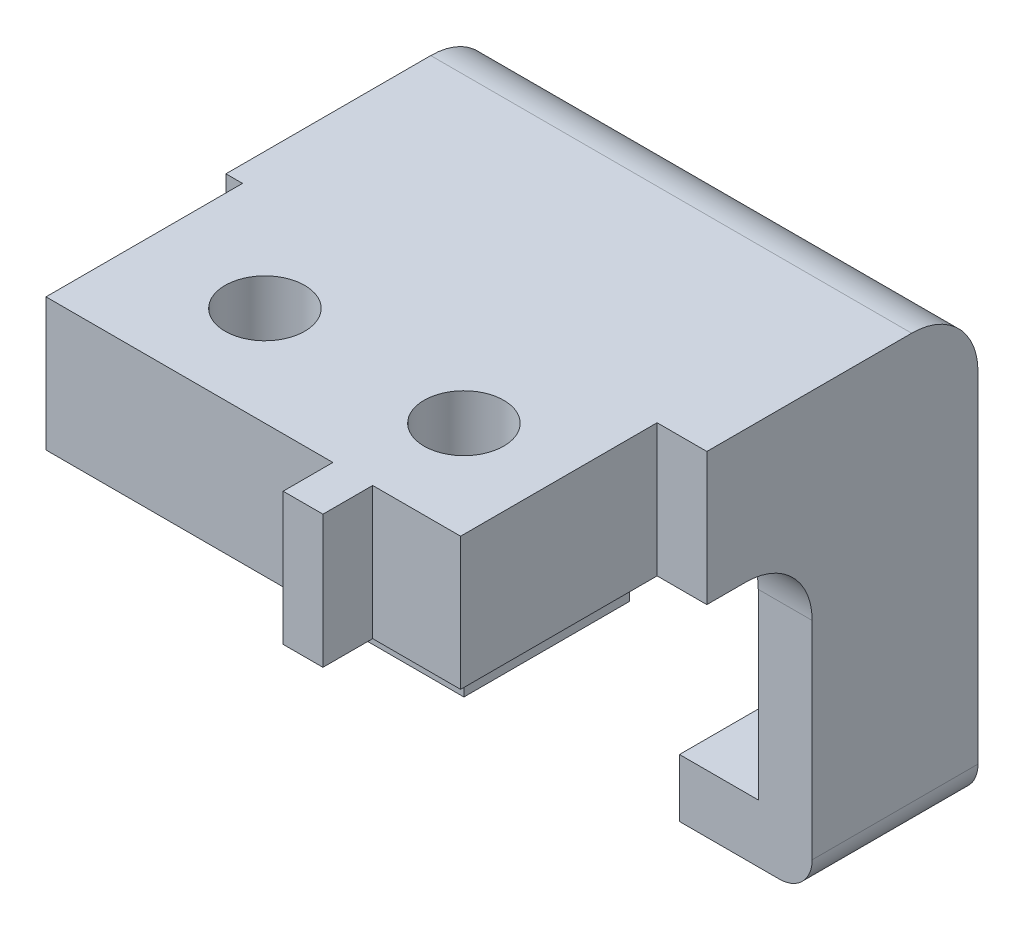
from build123d import *
from OCP.BRepFilletAPI import BRepFilletAPI_MakeChamfer
from build123d.topology import SkipClean

# Parameters (mm, degrees)
SKETCH1_R                      = 3.1
SKETCH1_R_2                    = 3.5
SKETCH1_W                      = 32
SKETCH1_H                      = 15.65
BOSS_EXTRUDE1_DEPTH            = 11.7
CUT_EXTRUDE5_DEPTH             = 14
CUT_EXTRUDE8_REACH             = 96.23
SKETCH10_R                     = 1.675
CUT_EXTRUDE8_DIRECTION_2_REACH = 96.23
CUT_EXTRUDE9_REACH             = 94.724
SKETCH11_R                     = 1.625
CUT_EXTRUDE9_DIRECTION_2_REACH = 94.724
CUT_EXTRUDE10_DEPTH            = 2.3
CUT_EXTRUDE11_DEPTH            = 2.3
HOLE1_D                        = 4.8
HOLE1_DEPTH                    = 12
HOLE1_CBORE_D                  = 5.4
HOLE1_CBORE_DEPTH              = 6
CUT_EXTRUDE17_REACH            = 66.001
SKETCH30_W                     = 59.4
SKETCH30_H                     = 25.65
SKETCH32_W                     = 99
SKETCH32_H                     = 8
CUT_EXTRUDE20_DEPTH            = 65.000566192
CHAMFER1_SIZE                  = 6
CHAMFER1_SIZE_2                = 0.3
FILLET1_R                      = 2
SKETCH33_W                     = 2.4
SKETCH33_H                     = 5.3
BOSS_EXTRUDE2_DEPTH            = 3
SKETCH34_W                     = 99
SKETCH34_H                     = 8
CUT_EXTRUDE21_DEPTH            = 61.759087383
CUT_EXTRUDE22_START            = -11.7
CUT_EXTRUDE22_DEPTH            = 11.7
BOSS_EXTRUDE4_DEPTH            = 8
SKETCH37_W                     = 25
SKETCH37_H                     = 8
BOSS_EXTRUDE5_DEPTH            = 16.5
SKETCH39_W                     = 25
SKETCH39_H                     = 10
BOSS_EXTRUDE6_DEPTH            = 15
SKETCH40_W                     = 22.5
SKETCH40_H                     = 12
CUT_EXTRUDE23_DEPTH            = 72.876300078
FILLET2_R                      = 4
CUT_EXTRUDE26_DEPTH            = 67.820749119
SKETCH49_W                     = 5
SKETCH49_H                     = 3.5
SKETCH49_W_2                   = 7
BOSS_EXTRUDE7_DEPTH            = 10
M4_CLEARANCE_HOLE1_D           = 4.8
CUT_EXTRUDE27_DEPTH            = 3.25
BOSS_EXTRUDE9_DEPTH            = 3
CHAMFER2_START                 = 11.446819666
CHAMFER2_DEPTH                 = 22.5
BOSS_EXTRUDE10_START           = -25
BOSS_EXTRUDE10_DEPTH           = 1
FILLET3_R                      = 2


with BuildPart() as part:
    # Sketch1 → Boss-Extrude1 (new body)
    with BuildSketch(Plane.XY):
        Polygon((-43.303180334, 29.275360835), (25.696819666, 29.275360835), (55.696819666, 29.275360835), (55.696819666, -18.024639165), (-43.303180334, -18.024639165), align=None)
        with Locations((-32.303180334, 10.275360835)):
            Circle(SKETCH1_R, mode=Mode.SUBTRACT)
        with Locations((44.696819666, 10.275360835)):
            Circle(SKETCH1_R, mode=Mode.SUBTRACT)
        with Locations((22.696819666, 12.275360835)):
            Circle(SKETCH1_R_2, mode=Mode.SUBTRACT)
        with Locations((-6.803180334, 11.450360835)):
            Rectangle(SKETCH1_W, SKETCH1_H, mode=Mode.SUBTRACT)
    extrude(amount=-BOSS_EXTRUDE1_DEPTH)

    # Sketch7 → Cut-Extrude5 (cut)
    with BuildSketch(Plane.XY):
        with BuildLine():
            Line((-43.303180334, 22.775360835), (-22.503180334, 22.775360835))
            Line((-22.503180334, 22.775360835), (-22.503180334, 3.625360835))
            Line((-22.503180334, 3.625360835), (-24.503180334, 3.625360835))
            Line((-24.503180334, 3.625360835), (-24.503180334, 21.275360835))
            Line((-24.503180334, 21.275360835), (-31.503180334, 21.275360835))
            Line((-31.503180334, 21.275360835), (-31.503180334, 13.270356662))
            ThreePointArc((-31.503180334, 13.270356662), (-32.303180334, 7.175360835), (-33.103180334, 13.270356662))
            Line((-33.103180334, 13.270356662), (-33.103180334, 21.275360835))
            Line((-33.103180334, 21.275360835), (-40.103180334, 21.275360835))
            Line((-40.103180334, 21.275360835), (-40.103180334, 3.625360835))
            Line((-40.103180334, 3.625360835), (-43.303180334, 3.625360835))
            Line((-43.303180334, 3.625360835), (-43.303180334, 22.775360835))
        make_face()
        with BuildLine():
            Line((34.896819666, 22.775360835), (55.696819666, 22.775360835))
            Line((55.696819666, 22.775360835), (55.696819666, 3.625360835))
            Line((55.696819666, 3.625360835), (52.496819666, 3.625360835))
            Line((52.496819666, 3.625360835), (52.496819666, 21.275360835))
            Line((52.496819666, 21.275360835), (45.496819666, 21.275360835))
            Line((45.496819666, 21.275360835), (45.496819666, 13.270356662))
            ThreePointArc((45.496819666, 13.270356662), (44.696819666, 7.175360835), (43.896819666, 13.270356662))
            Line((43.896819666, 13.270356662), (43.896819666, 21.275360835))
            Line((43.896819666, 21.275360835), (36.896819666, 21.275360835))
            Line((36.896819666, 21.275360835), (36.896819666, 3.625360835))
            Line((36.896819666, 3.625360835), (34.896819666, 3.625360835))
            Line((34.896819666, 3.625360835), (34.896819666, 22.775360835))
        make_face()
    extrude(amount=-CUT_EXTRUDE5_DEPTH, mode=Mode.SUBTRACT)

    # Sketch10 → Cut-Extrude8 (cut, up to next)
    with BuildSketch(Plane(origin=(-33.103180334, 0, 0), x_dir=(0, 0, -1), z_dir=(1, 0, 0)), mode=Mode.PRIVATE) as cut_extrude8_sk1:
        with Locations(Location((5.85, 17.272858748, 0), (0, 0, 270))):
            Circle(SKETCH10_R)
    cut_extrude8_tool1 = extrude(cut_extrude8_sk1.sketch, amount=-CUT_EXTRUDE8_REACH, mode=Mode.PRIVATE) & part.part
    add(cut_extrude8_tool1.solids().sort_by_distance((-33.10318, 17.272859, -5.85))[0], mode=Mode.SUBTRACT)

    # Sketch10 → Cut-Extrude8 direction 2 (cut, up to next)
    with BuildSketch(Plane(origin=(-33.103180334, 0, 0), x_dir=(0, 0, -1), z_dir=(1, 0, 0)), mode=Mode.PRIVATE) as cut_extrude8_direction_2_sk1:
        with Locations(Location((5.85, 17.272858748, 0), (0, 0, 270))):
            Circle(SKETCH10_R)
    cut_extrude8_direction_2_tool1 = extrude(cut_extrude8_direction_2_sk1.sketch, amount=CUT_EXTRUDE8_DIRECTION_2_REACH, mode=Mode.PRIVATE) & part.part
    add(cut_extrude8_direction_2_tool1.solids().sort_by_distance((-33.10318, 17.272859, -5.85))[0], mode=Mode.SUBTRACT)

    # Sketch11 → Cut-Extrude9 (cut, up to next)
    with BuildSketch(Plane(origin=(43.896819666, 0, 0), x_dir=(0, 0, -1), z_dir=(1, 0, 0)), mode=Mode.PRIVATE) as cut_extrude9_sk1:
        with Locations(Location((5.85, 17.272858748, 0), (0, 0, 180))):
            Circle(SKETCH11_R)
    cut_extrude9_tool1 = extrude(cut_extrude9_sk1.sketch, amount=-CUT_EXTRUDE9_REACH, mode=Mode.PRIVATE) & part.part
    add(cut_extrude9_tool1.solids().sort_by_distance((43.89682, 17.272859, -5.85))[0], mode=Mode.SUBTRACT)

    # Sketch11 → Cut-Extrude9 direction 2 (cut, up to next)
    with BuildSketch(Plane(origin=(43.896819666, 0, 0), x_dir=(0, 0, -1), z_dir=(1, 0, 0)), mode=Mode.PRIVATE) as cut_extrude9_direction_2_sk1:
        with Locations(Location((5.85, 17.272858748, 0), (0, 0, 180))):
            Circle(SKETCH11_R)
    cut_extrude9_direction_2_tool1 = extrude(cut_extrude9_direction_2_sk1.sketch, amount=CUT_EXTRUDE9_DIRECTION_2_REACH, mode=Mode.PRIVATE) & part.part
    add(cut_extrude9_direction_2_tool1.solids().sort_by_distance((43.89682, 17.272859, -5.85))[0], mode=Mode.SUBTRACT)

    # Sketch12 → Cut-Extrude10 (cut)
    with BuildSketch(Plane.ZY.offset(-36.896819666)):
        Polygon((-4.146816706, 20.222858748), (0, 20.222858748), (0, 14.322858748), (-4.146816706, 14.322858748), (-7.553183294, 14.322858748), (-9.256366588, 17.272858748), (-7.553183294, 20.222858748), align=None)
    extrude(amount=-CUT_EXTRUDE10_DEPTH, mode=Mode.SUBTRACT)

    # Sketch13 → Cut-Extrude11 (cut)
    with BuildSketch(Plane(origin=(-24.503180334, 0, 0), x_dir=(0, 0, -1), z_dir=(1, 0, 0))):
        Polygon((4.146816706, 20.222858748), (0, 20.222858748), (0, 14.322858748), (4.146816706, 14.322858748), (7.553183294, 14.322858748), (9.256366588, 17.272858748), (7.553183294, 20.222858748), align=None)
    extrude(amount=-CUT_EXTRUDE11_DEPTH, mode=Mode.SUBTRACT)

    # Hole1
    with Locations(Plane(origin=(0, 3.625360835, 0), x_dir=(1, 0, 0), z_dir=(0, 1, 0))):
        with Locations((-15.653180334, 5.85), (0.346819666, 5.85)):
            CounterBoreHole(HOLE1_D / 2, HOLE1_CBORE_D / 2, HOLE1_CBORE_DEPTH, depth=HOLE1_DEPTH)

    # Sketch30 → Cut-Extrude17 (cut, up to next)
    with BuildSketch(Plane(origin=(0, 0, -11.7), x_dir=(-1, 0, 0), z_dir=(0, 0, -1)), mode=Mode.PRIVATE) as cut_extrude17_sk1:
        with Locations((-5.196819666, 16.450360835)):
            Rectangle(SKETCH30_W, SKETCH30_H)
    cut_extrude17_tool1 = extrude(cut_extrude17_sk1.sketch, amount=-CUT_EXTRUDE17_REACH, mode=Mode.PRIVATE) & part.part
    add(cut_extrude17_tool1.solids().sort_by_distance((5.19682, 16.450361, -11.7))[0], mode=Mode.SUBTRACT)


with BuildPart() as cut_extrude17_piece_1:
    # of the separate pieces the step leaves, piece 1, a body of its own (cut_extrude17_pieces)
    add(part.part.solids().sort_by_distance((-24.503180334, 3.625360835, 0))[0])

    # Chamfer1
    chamfer1_edges_1 = [cut_extrude17_piece_1.edges().sort_by_distance(p)[0] for p in [
        (-2.353180334, -2.374639165, -5.85),
    ]]
    chamfer1_side_1 = [cut_extrude17_piece_1.faces().sort_by_distance(p)[0] for p in [
        (-2.353180334, -2.368639165, -5.85),
    ]]
    chamfer1_edges_2 = [cut_extrude17_piece_1.edges().sort_by_distance(p)[0] for p in [
        (-18.353180334, -2.374639165, -5.85),
    ]]
    chamfer1_side_2 = [cut_extrude17_piece_1.faces().sort_by_distance(p)[0] for p in [
        (-18.353180334, -2.368639165, -5.85),
    ]]
    chamfer1 = BRepFilletAPI_MakeChamfer(cut_extrude17_piece_1.part.solid().wrapped)
    for e in chamfer1_edges_1:
        chamfer1.Add(CHAMFER1_SIZE - 0.0001, CHAMFER1_SIZE_2 - 0.0001, e.wrapped, chamfer1_side_1[0].wrapped)
    for e in chamfer1_edges_2:
        chamfer1.Add(CHAMFER1_SIZE - 0.0001, CHAMFER1_SIZE_2 - 0.0001, e.wrapped, chamfer1_side_2[0].wrapped)
    add(Compound.cast(chamfer1.Shape()), mode=Mode.REPLACE)  # a hair under: the kernel refuses the full size

    # Fillet1
    # the kernel refuses this fillet: 2 mm, written as the material it takes off along each edge
    with BuildSketch(Plane(origin=(50.496819666, 19.275360835, -2), x_dir=(1, 0, 0), z_dir=(0, 1, 0))) as fillet1_piece_1_section:
        Polygon((0, 0), (FILLET1_R, 0), (FILLET1_R, -FILLET1_R), (0, -FILLET1_R), align=None)
    fillet1_piece_1 = extrude(amount=FILLET1_R, mode=Mode.PRIVATE)
    fillet1_piece_1 = fillet1_piece_1 - Plane(origin=(50.496819666, 19.275360835, -2), x_dir=(-0.7071067811865475, 0, -0.7071067811865475), z_dir=(0, 1, 0)) * Sphere(FILLET1_R, mode=Mode.PRIVATE)
    add(fillet1_piece_1, mode=Mode.SUBTRACT)
    with BuildSketch(Plane(origin=(50.496819666, 19.275360835, -9.7), x_dir=(1, 0, 0), z_dir=(0, 1, 0))) as fillet1_piece_2_section:
        Polygon((0, 0), (FILLET1_R, 0), (FILLET1_R, FILLET1_R), (0, FILLET1_R), align=None)
    fillet1_piece_2 = extrude(amount=FILLET1_R, mode=Mode.PRIVATE)
    fillet1_piece_2 = fillet1_piece_2 - Plane(origin=(50.496819666, 19.275360835, -9.7), x_dir=(-0.7071067811865475, 0, 0.7071067811865475), z_dir=(0, 1, 0)) * Sphere(FILLET1_R, mode=Mode.PRIVATE)
    add(fillet1_piece_2, mode=Mode.SUBTRACT)
    with BuildSketch(Plane(origin=(38.896819666, 19.275360835, -9.7), x_dir=(-1, 0, 0), z_dir=(0, 0, -1))) as fillet1_piece_3_section:
        Polygon((0, 0), (FILLET1_R, 0), (FILLET1_R, FILLET1_R), (0, FILLET1_R), align=None)
    fillet1_piece_3 = extrude(amount=FILLET1_R, mode=Mode.PRIVATE)
    fillet1_piece_3 = fillet1_piece_3 - Plane(origin=(38.896819666, 19.275360835, -9.7), x_dir=(0.7071067811865475, -0.7071067811865475, 0), z_dir=(0, 0, -1)) * Sphere(FILLET1_R, mode=Mode.PRIVATE)
    add(fillet1_piece_3, mode=Mode.SUBTRACT)
    with BuildSketch(Plane(origin=(-38.103180334, 19.275360835, -2), x_dir=(0, 1, 0), z_dir=(-1, 0, 0))) as fillet1_piece_4_section:
        Polygon((0, 0), (FILLET1_R, 0), (FILLET1_R, -FILLET1_R), (0, -FILLET1_R), align=None)
    fillet1_piece_4 = extrude(amount=FILLET1_R, mode=Mode.PRIVATE)
    fillet1_piece_4 = fillet1_piece_4 - Plane(origin=(-38.103180334, 19.275360835, -2), x_dir=(0, -0.7071067811865475, -0.7071067811865475), z_dir=(-1, 0, 0)) * Sphere(FILLET1_R, mode=Mode.PRIVATE)
    add(fillet1_piece_4, mode=Mode.SUBTRACT)
    with BuildSketch(Plane(origin=(-38.103180334, 19.275360835, -9.7), x_dir=(0, 1, 0), z_dir=(-1, 0, 0))) as fillet1_piece_5_section:
        Polygon((0, 0), (FILLET1_R, 0), (FILLET1_R, FILLET1_R), (0, FILLET1_R), align=None)
    fillet1_piece_5 = extrude(amount=FILLET1_R, mode=Mode.PRIVATE)
    fillet1_piece_5 = fillet1_piece_5 - Plane(origin=(-38.103180334, 19.275360835, -9.7), x_dir=(0, -0.7071067811865475, 0.7071067811865475), z_dir=(-1, 0, 0)) * Sphere(FILLET1_R, mode=Mode.PRIVATE)
    add(fillet1_piece_5, mode=Mode.SUBTRACT)
    with BuildSketch(Plane(origin=(-26.503180334, 19.275360835, -9.7), x_dir=(0, 0, -1), z_dir=(1, 0, 0))) as fillet1_piece_6_section:
        Polygon((0, 0), (FILLET1_R, 0), (FILLET1_R, FILLET1_R), (0, FILLET1_R), align=None)
    fillet1_piece_6 = extrude(amount=FILLET1_R, mode=Mode.PRIVATE)
    fillet1_piece_6 = fillet1_piece_6 - Plane(origin=(-26.503180334, 19.275360835, -9.7), x_dir=(0, -0.7071067811865475, 0.7071067811865475), z_dir=(1, 0, 0)) * Sphere(FILLET1_R, mode=Mode.PRIVATE)
    add(fillet1_piece_6, mode=Mode.SUBTRACT)
    with BuildSketch(Plane(origin=(52.496819666, 21.275360835, -2), x_dir=(-1, 0, 0), z_dir=(0, 0, -1)), Plane(origin=(-40.103180334, 21.275360835, -2), x_dir=(0, -1, 0), z_dir=(0, 0, -1))) as fillet1_piece_7:
        with BuildLine():
            CenterArc((FILLET1_R, -FILLET1_R), FILLET1_R, 90, 90)
            Line((0, -FILLET1_R), (0, 0))
            Line((0, 0), (FILLET1_R, 0))
        make_face()
    extrude(amount=7.7, mode=Mode.SUBTRACT)
    with BuildSketch(Plane(origin=(50.496819666, 21.275360835, 0), x_dir=(0, -1, 0), z_dir=(-1, 0, 0)), Plane(origin=(40.496819666, 21.275360835, -11.7), x_dir=(0, -1, 0), z_dir=(1, 0, 0)), Plane(origin=(38.896819666, 21.275360835, -11.7), x_dir=(0, -1, 0), z_dir=(1, 0, 0)), Plane(origin=(-28.103180334, 21.275360835, 0), x_dir=(0, -1, 0), z_dir=(-1, 0, 0)), Plane(origin=(-38.103180334, 21.275360835, -11.7), x_dir=(0, -1, 0), z_dir=(1, 0, 0)), Plane(origin=(-36.503180334, 21.275360835, -11.7), x_dir=(0, -1, 0), z_dir=(1, 0, 0))) as fillet1_piece_8:
        with BuildLine():
            CenterArc((FILLET1_R, -FILLET1_R), FILLET1_R, 90, 90)
            Line((0, -FILLET1_R), (0, 0))
            Line((0, 0), (FILLET1_R, 0))
        make_face()
    extrude(amount=10, mode=Mode.SUBTRACT)
    with BuildSketch(Plane(origin=(45.496819666, 21.275360835, 5), x_dir=(0, -1, 0), z_dir=(0, 0, -1)), Plane(origin=(43.896819666, 21.275360835, 5), x_dir=(-1, 0, 0), z_dir=(0, 0, -1)), Plane(origin=(-33.103180334, 21.275360835, 5), x_dir=(-1, 0, 0), z_dir=(0, 0, -1)), Plane(origin=(55.696819666, 3.625360835, 5), x_dir=(-1, 0, 0), z_dir=(0, 0, -1)), Plane(origin=(-43.303180334, 3.625360835, 5), x_dir=(0, -1, 0), z_dir=(0, 0, -1))) as fillet1_piece_9:
        with BuildLine():
            CenterArc((FILLET1_R, -FILLET1_R), FILLET1_R, 90, 90)
            Line((0, -FILLET1_R), (0, 0))
            Line((0, 0), (FILLET1_R, 0))
        make_face()
    extrude(amount=21.7, mode=Mode.SUBTRACT)
    with BuildSketch(Plane(origin=(48.896819666, 21.275360835, 0), x_dir=(0, -1, 0), z_dir=(-1, 0, 0)), Plane(origin=(-19.503180334, 21.275360835, 0), x_dir=(0, -1, 0), z_dir=(-1, 0, 0))) as fillet1_piece_10:
        with BuildLine():
            CenterArc((FILLET1_R, -FILLET1_R), FILLET1_R, 90, 90)
            Line((0, -FILLET1_R), (0, 0))
            Line((0, 0), (FILLET1_R, 0))
        make_face()
    extrude(amount=17, mode=Mode.SUBTRACT)
    with BuildSketch(Plane(origin=(36.896819666, 21.275360835, 5), x_dir=(0, -1, 0), z_dir=(0, 0, -1))) as fillet1_piece_11:
        with BuildLine():
            CenterArc((FILLET1_R, -FILLET1_R), FILLET1_R, 90, 90)
            Line((0, -FILLET1_R), (0, 0))
            Line((0, 0), (FILLET1_R, 0))
        make_face()
    extrude(amount=14.7, mode=Mode.SUBTRACT)
    with BuildSketch(Plane(origin=(-24.503180334, 21.275360835, 5), x_dir=(0, -1, 0), z_dir=(0, 0, -1))) as fillet1_piece_12:
        with BuildLine():
            CenterArc((FILLET1_R, FILLET1_R), FILLET1_R, 180, 90)
            Line((0, FILLET1_R), (0, 0))
            Line((0, 0), (FILLET1_R, 0))
        make_face()
    extrude(amount=14.7, mode=Mode.SUBTRACT)
    with BuildSketch(Plane(origin=(-31.503180334, 21.275360835, 5), x_dir=(1, 0, 0), z_dir=(0, 0, -1))) as fillet1_piece_13:
        with BuildLine():
            CenterArc((FILLET1_R, FILLET1_R), FILLET1_R, 180, 90)
            Line((0, FILLET1_R), (0, 0))
            Line((0, 0), (FILLET1_R, 0))
        make_face()
    extrude(amount=21.7, mode=Mode.SUBTRACT)
    with BuildSketch(Plane(origin=(55.696819666, 8.625360835, 0), x_dir=(-1, 0, 0), z_dir=(0, -1, 0)), Plane(origin=(-43.303180334, -23.024639165, 0), x_dir=(1, 0, 0), z_dir=(0, 1, 0))) as fillet1_piece_14:
        with BuildLine():
            CenterArc((FILLET1_R, FILLET1_R), FILLET1_R, 180, 90)
            Line((0, FILLET1_R), (0, 0))
            Line((0, 0), (FILLET1_R, 0))
        make_face()
    extrude(amount=31.65, mode=Mode.SUBTRACT)
    with BuildSketch(Plane(origin=(55.696819666, 8.625360835, -11.7), x_dir=(-1, 0, 0), z_dir=(0, -1, 0)), Plane(origin=(-43.303180334, -23.024639165, -11.7), x_dir=(1, 0, 0), z_dir=(0, 1, 0))) as fillet1_piece_15:
        with BuildLine():
            CenterArc((FILLET1_R, -FILLET1_R), FILLET1_R, 90, 90)
            Line((0, -FILLET1_R), (0, 0))
            Line((0, 0), (FILLET1_R, 0))
        make_face()
    extrude(amount=31.65, mode=Mode.SUBTRACT)
    with BuildSketch(Plane(origin=(36.896819666, 3.625360835, -11.7), x_dir=(0, 0, 1), z_dir=(-1, 0, 0))) as fillet1_piece_16:
        with BuildLine():
            CenterArc((FILLET1_R, -FILLET1_R), FILLET1_R, 90, 90)
            Line((0, -FILLET1_R), (0, 0))
            Line((0, 0), (FILLET1_R, 0))
        make_face()
    extrude(amount=61.4, mode=Mode.SUBTRACT)
    with BuildSketch(Plane(origin=(36.896819666, 3.625360835, 0), x_dir=(0, 0, -1), z_dir=(-1, 0, 0))) as fillet1_piece_17:
        with BuildLine():
            CenterArc((FILLET1_R, FILLET1_R), FILLET1_R, 180, 90)
            Line((0, FILLET1_R), (0, 0))
            Line((0, 0), (FILLET1_R, 0))
        make_face()
    extrude(amount=61.4, mode=Mode.SUBTRACT)
    with BuildSketch(Plane(origin=(36.896819666, 19.322858748, 0), x_dir=(0, 0, -1), z_dir=(0, -1, 0)), Plane(origin=(-24.503180334, 3.625360835, 0), x_dir=(0, 0, -1), z_dir=(0, 1, 0))) as fillet1_piece_18:
        with BuildLine():
            CenterArc((FILLET1_R, FILLET1_R), FILLET1_R, 180, 90)
            Line((0, FILLET1_R), (0, 0))
            Line((0, 0), (FILLET1_R, 0))
        make_face()
    extrude(amount=15.697497913, mode=Mode.SUBTRACT)
    with BuildSketch(Plane(origin=(52.496819666, 3.625360835, 0), x_dir=(-1, 0, 0), z_dir=(0, 1, 0)), Plane(origin=(36.896819666, 3.625360835, -11.7), x_dir=(1, 0, 0), z_dir=(0, 1, 0)), Plane(origin=(52.496819666, 19.275360835, -11.7), x_dir=(-1, 0, 0), z_dir=(0, -1, 0)), Plane(origin=(-40.103180334, 19.275360835, 0), x_dir=(1, 0, 0), z_dir=(0, -1, 0)), Plane(origin=(-40.103180334, 3.625360835, -11.7), x_dir=(1, 0, 0), z_dir=(0, 1, 0))) as fillet1_piece_19:
        with BuildLine():
            CenterArc((FILLET1_R, -FILLET1_R), FILLET1_R, 90, 90)
            Line((0, -FILLET1_R), (0, 0))
            Line((0, 0), (FILLET1_R, 0))
        make_face()
    extrude(amount=15.65, mode=Mode.SUBTRACT)
    with BuildSketch(Plane(origin=(-24.503180334, 19.275360835, -11.7), x_dir=(0, 0, 1), z_dir=(0, -1, 0))) as fillet1_piece_20:
        with BuildLine():
            CenterArc((FILLET1_R, FILLET1_R), FILLET1_R, 180, 90)
            Line((0, FILLET1_R), (0, 0))
            Line((0, 0), (FILLET1_R, 0))
        make_face()
    extrude(amount=15.65, mode=Mode.SUBTRACT)
    with BuildSketch(Plane(origin=(41.896819666, 3.625360835, -11.7), x_dir=(0, 0, 1), z_dir=(-1, 0, 0))) as fillet1_piece_21a_section:
        with BuildLine():
            CenterArc((FILLET1_R, -FILLET1_R), FILLET1_R, 90, 90)
            Line((0, -FILLET1_R), (0, 0))
            Line((0, 0), (FILLET1_R, 0))
        make_face()
    fillet1_piece_21a = extrude(amount=66.4, mode=Mode.PRIVATE)
    fillet1_piece_21a = split(fillet1_piece_21a, bisect_by=Plane(origin=(36.896819666, 3.625360835, -11.7), z_dir=(1, 0, 0)), keep=Keep.TOP, mode=Mode.PRIVATE)
    with BuildSketch(Plane(origin=(36.896819666, -1.374639165, -11.7), x_dir=(1, 0, 0), z_dir=(0, 1, 0))) as fillet1_piece_21b_section:
        with BuildLine():
            CenterArc((FILLET1_R, -FILLET1_R), FILLET1_R, 90, 90)
            Line((0, -FILLET1_R), (0, 0))
            Line((0, 0), (FILLET1_R, 0))
        make_face()
    fillet1_piece_21b = extrude(amount=20.65, mode=Mode.PRIVATE)
    fillet1_piece_21b = split(fillet1_piece_21b, bisect_by=Plane(origin=(36.896819666, 3.625360835, -11.7), z_dir=(0, -1, 0)), keep=Keep.TOP, mode=Mode.PRIVATE)
    fillet1_piece_21 = fillet1_piece_21a & fillet1_piece_21b
    add(fillet1_piece_21, mode=Mode.SUBTRACT)
    with BuildSketch(Plane(origin=(36.896819666, 3.625360835, -11.7), x_dir=(0, 0, 1), z_dir=(-1, 0, 0))) as fillet1_piece_22a_section:
        with BuildLine():
            CenterArc((FILLET1_R, -FILLET1_R), FILLET1_R, 90, 90)
            Line((0, -FILLET1_R), (0, 0))
            Line((0, 0), (FILLET1_R, 0))
        make_face()
    fillet1_piece_22a = extrude(amount=66.4, mode=Mode.PRIVATE)
    fillet1_piece_22a = split(fillet1_piece_22a, bisect_by=Plane(origin=(-24.503180334, 3.625360835, -11.7), z_dir=(-1, 0, 0)), keep=Keep.TOP, mode=Mode.PRIVATE)
    with BuildSketch(Plane(origin=(-24.503180334, 19.275360835, -11.7), x_dir=(0, 0, 1), z_dir=(0, -1, 0))) as fillet1_piece_22b_section:
        with BuildLine():
            CenterArc((FILLET1_R, FILLET1_R), FILLET1_R, 180, 90)
            Line((0, FILLET1_R), (0, 0))
            Line((0, 0), (FILLET1_R, 0))
        make_face()
    fillet1_piece_22b = extrude(amount=20.65, mode=Mode.PRIVATE)
    fillet1_piece_22b = split(fillet1_piece_22b, bisect_by=Plane(origin=(-24.503180334, 3.625360835, -11.7), z_dir=(0, -1, 0)), keep=Keep.TOP, mode=Mode.PRIVATE)
    fillet1_piece_22 = fillet1_piece_22a & fillet1_piece_22b
    add(fillet1_piece_22, mode=Mode.SUBTRACT)
    with BuildSketch(Plane(origin=(41.896819666, 3.625360835, 0), x_dir=(0, 0, -1), z_dir=(-1, 0, 0))) as fillet1_piece_23a_section:
        with BuildLine():
            CenterArc((FILLET1_R, FILLET1_R), FILLET1_R, 180, 90)
            Line((0, FILLET1_R), (0, 0))
            Line((0, 0), (FILLET1_R, 0))
        make_face()
    fillet1_piece_23a = extrude(amount=66.4, mode=Mode.PRIVATE)
    fillet1_piece_23a = split(fillet1_piece_23a, bisect_by=Plane(origin=(36.896819666, 3.625360835, 0), z_dir=(1, 0, 0)), keep=Keep.TOP, mode=Mode.PRIVATE)
    with BuildSketch(Plane(origin=(36.896819666, 19.322858748, 0), x_dir=(0, 0, -1), z_dir=(0, -1, 0))) as fillet1_piece_23b_section:
        with BuildLine():
            CenterArc((FILLET1_R, FILLET1_R), FILLET1_R, 180, 90)
            Line((0, FILLET1_R), (0, 0))
            Line((0, 0), (FILLET1_R, 0))
        make_face()
    fillet1_piece_23b = extrude(amount=20.697497913, mode=Mode.PRIVATE)
    fillet1_piece_23b = split(fillet1_piece_23b, bisect_by=Plane(origin=(36.896819666, 3.625360835, 0), z_dir=(0, -1, 0)), keep=Keep.TOP, mode=Mode.PRIVATE)
    fillet1_piece_23 = fillet1_piece_23a & fillet1_piece_23b
    add(fillet1_piece_23, mode=Mode.SUBTRACT)
    with BuildSketch(Plane(origin=(36.896819666, 3.625360835, 0), x_dir=(0, 0, -1), z_dir=(-1, 0, 0))) as fillet1_piece_24a_section:
        with BuildLine():
            CenterArc((FILLET1_R, FILLET1_R), FILLET1_R, 180, 90)
            Line((0, FILLET1_R), (0, 0))
            Line((0, 0), (FILLET1_R, 0))
        make_face()
    fillet1_piece_24a = extrude(amount=66.4, mode=Mode.PRIVATE)
    fillet1_piece_24a = split(fillet1_piece_24a, bisect_by=Plane(origin=(-24.503180334, 3.625360835, 0), z_dir=(-1, 0, 0)), keep=Keep.TOP, mode=Mode.PRIVATE)
    with BuildSketch(Plane(origin=(-24.503180334, -1.374639165, 0), x_dir=(0, 0, -1), z_dir=(0, 1, 0))) as fillet1_piece_24b_section:
        with BuildLine():
            CenterArc((FILLET1_R, FILLET1_R), FILLET1_R, 180, 90)
            Line((0, FILLET1_R), (0, 0))
            Line((0, 0), (FILLET1_R, 0))
        make_face()
    fillet1_piece_24b = extrude(amount=20.697497913, mode=Mode.PRIVATE)
    fillet1_piece_24b = split(fillet1_piece_24b, bisect_by=Plane(origin=(-24.503180334, 3.625360835, 0), z_dir=(0, -1, 0)), keep=Keep.TOP, mode=Mode.PRIVATE)
    fillet1_piece_24 = fillet1_piece_24a & fillet1_piece_24b
    add(fillet1_piece_24, mode=Mode.SUBTRACT)

    # Sketch33 → Boss-Extrude2 (add)
    with BuildSketch(Plane.XY):
        with Locations((27.696819666, -7.374639165)):
            Rectangle(SKETCH33_W, SKETCH33_H)
    extrude(amount=BOSS_EXTRUDE2_DEPTH)

    # Sketch34 → Cut-Extrude21 (cut, through all)
    with BuildSketch(Plane.XY):
        with Locations((6.196819666, -14.024639165)):
            Rectangle(SKETCH34_W, SKETCH34_H)
    extrude(amount=-CUT_EXTRUDE21_DEPTH, mode=Mode.SUBTRACT)

    # Sketch35 → Cut-Extrude22 (cut)
    with BuildSketch(Plane.XY.offset(CUT_EXTRUDE22_START)):
        Polygon((17.396819666, 3.625360835), (28.359065589, 3.625360835), (34.396819666, 3.625360835), (34.396819666, -4.374639165), (10.396819666, -4.374639165), (10.396819666, 1.625360835), (10.396819666, 3.625360835), align=None)
    extrude(amount=CUT_EXTRUDE22_DEPTH, mode=Mode.SUBTRACT)

    # Sketch36 → Boss-Extrude4 (add)
    with SkipClean():  # the faces are left unmerged after this step: merging them gives an invalid solid
        with BuildSketch(Plane.XZ.offset(10.024639165)):
            with BuildLine():
                Line((26.496819666, 3), (26.496819666, 0))
                Line((26.496819666, 0), (-41.303180334, 0))
                ThreePointArc((-41.303180334, 0), (-42.717393896, -0.585786438), (-43.303180334, -2))
                Line((-43.303180334, -2), (-43.303180334, -9.7))
                ThreePointArc((-43.303180334, -9.7), (-42.717393896, -11.114213562), (-41.303180334, -11.7))
                Line((-41.303180334, -11.7), (53.696819666, -11.7))
                ThreePointArc((53.696819666, -11.7), (55.111033228, -11.114213562), (55.696819666, -9.7))
                Line((55.696819666, -9.7), (55.696819666, -2))
                ThreePointArc((55.696819666, -2), (55.111033228, -0.585786438), (53.696819666, 0))
                Line((53.696819666, 0), (28.896819666, 0))
                Line((28.896819666, 0), (28.896819666, 3))
                Line((28.896819666, 3), (26.496819666, 3))
            make_face()
        extrude(amount=BOSS_EXTRUDE4_DEPTH)

    # Sketch37 → Boss-Extrude5 (add)
    with SkipClean():  # the faces are left unmerged after this step: merging them gives an invalid solid
        with BuildSketch(Plane(origin=(0, 0, -11.7), x_dir=(-1, 0, 0), z_dir=(0, 0, -1))):
            with Locations((-21.696819666, -14.024639165)):
                Rectangle(SKETCH37_W, SKETCH37_H)
        extrude(amount=BOSS_EXTRUDE5_DEPTH)

    # Sketch39 → Boss-Extrude6 (add)
    with SkipClean():  # the faces are left unmerged after this step: merging them gives an invalid solid
        with BuildSketch(Plane.XZ.offset(18.024639165)):
            with Locations((21.696819666, -23.2)):
                Rectangle(SKETCH39_W, SKETCH39_H)
        extrude(amount=BOSS_EXTRUDE6_DEPTH)

    # Sketch40 → Cut-Extrude23 (cut, through all)
    with SkipClean():  # the faces are left unmerged after this step: merging them gives an invalid solid
        with BuildSketch(Plane(origin=(0, 0, -28.2), x_dir=(-1, 0, 0), z_dir=(0, 0, -1))):
            with Locations((-22.696819666, -27.024639165)):
                Rectangle(SKETCH40_W, SKETCH40_H)
        extrude(amount=-CUT_EXTRUDE23_DEPTH, mode=Mode.SUBTRACT)

    # Fillet2
    # the kernel refuses this fillet: 4 mm, written as the material it adds along each edge
    with BuildSketch(Plane(origin=(34.196819666, -18.024639165, -18.2), x_dir=(0, 0, 1), z_dir=(-1, 0, 0))) as fillet2_piece_1_section:
        with BuildLine():
            CenterArc((FILLET2_R, -FILLET2_R), FILLET2_R, 90, 90)
            Line((0, -FILLET2_R), (0, 0))
            Line((0, 0), (FILLET2_R, 0))
        make_face()
    fillet2_piece_1 = extrude(amount=25, mode=Mode.PRIVATE)
    fillet2_piece_1 = split(fillet2_piece_1, bisect_by=Plane(origin=(34.196819666, -21.024639165, -18.2), z_dir=(0, 1, 0)), keep=Keep.TOP, mode=Mode.PRIVATE)
    fillet2_piece_1 = split(fillet2_piece_1, bisect_by=Plane(origin=(33.946819666, -18.024639165, -18.2), z_dir=(1, 0, 0)), keep=Keep.TOP, mode=Mode.PRIVATE)
    add(fillet2_piece_1)
    with BuildSketch(Plane(origin=(34.196819666, -18.024639165, -18.2), x_dir=(0, 0, 1), z_dir=(-1, 0, 0))) as fillet2_piece_2_section:
        with BuildLine():
            CenterArc((FILLET2_R, -FILLET2_R), FILLET2_R, 90, 90)
            Line((0, -FILLET2_R), (0, 0))
            Line((0, 0), (FILLET2_R, 0))
        make_face()
    fillet2_piece_2 = extrude(amount=25, mode=Mode.PRIVATE)
    fillet2_piece_2 = split(fillet2_piece_2, bisect_by=Plane(origin=(34.196819666, -21.024639165, -18.2), z_dir=(0, -1, 0)), keep=Keep.TOP, mode=Mode.PRIVATE)
    fillet2_piece_2 = split(fillet2_piece_2, bisect_by=Plane(origin=(33.946819666, -18.024639165, -18.2), z_dir=(1, 0, 0)), keep=Keep.TOP, mode=Mode.PRIVATE)
    add(fillet2_piece_2)
    with BuildSketch(Plane(origin=(34.196819666, -18.024639165, -18.2), x_dir=(0, 0, 1), z_dir=(-1, 0, 0))) as fillet2_piece_3_section:
        with BuildLine():
            CenterArc((FILLET2_R, -FILLET2_R), FILLET2_R, 90, 90)
            Line((0, -FILLET2_R), (0, 0))
            Line((0, 0), (FILLET2_R, 0))
        make_face()
    fillet2_piece_3 = extrude(amount=25, mode=Mode.PRIVATE)
    fillet2_piece_3 = split(fillet2_piece_3, bisect_by=Plane(origin=(11.446819666, -18.024639165, -18.2), z_dir=(1, 0, 0)), keep=Keep.TOP, mode=Mode.PRIVATE)
    fillet2_piece_3 = split(fillet2_piece_3, bisect_by=Plane(origin=(34.196819666, -21.024639165, -18.2), z_dir=(0, 1, 0)), keep=Keep.TOP, mode=Mode.PRIVATE)
    fillet2_piece_3 = split(fillet2_piece_3, bisect_by=Plane(origin=(33.946819666, -18.024639165, -18.2), z_dir=(-1, 0, 0)), keep=Keep.TOP, mode=Mode.PRIVATE)
    add(fillet2_piece_3)
    with BuildSketch(Plane(origin=(34.196819666, -18.024639165, -18.2), x_dir=(0, 0, 1), z_dir=(-1, 0, 0))) as fillet2_piece_4_section:
        with BuildLine():
            CenterArc((FILLET2_R, -FILLET2_R), FILLET2_R, 90, 90)
            Line((0, -FILLET2_R), (0, 0))
            Line((0, 0), (FILLET2_R, 0))
        make_face()
    fillet2_piece_4 = extrude(amount=25, mode=Mode.PRIVATE)
    fillet2_piece_4 = split(fillet2_piece_4, bisect_by=Plane(origin=(11.446819666, -18.024639165, -18.2), z_dir=(-1, 0, 0)), keep=Keep.TOP, mode=Mode.PRIVATE)
    fillet2_piece_4 = split(fillet2_piece_4, bisect_by=Plane(origin=(34.196819666, -21.024639165, -18.2), z_dir=(0, 1, 0)), keep=Keep.TOP, mode=Mode.PRIVATE)
    add(fillet2_piece_4)
    with BuildSketch(Plane(origin=(34.196819666, -18.024639165, -18.2), x_dir=(0, 0, 1), z_dir=(-1, 0, 0))) as fillet2_piece_5_section:
        with BuildLine():
            CenterArc((FILLET2_R, -FILLET2_R), FILLET2_R, 90, 90)
            Line((0, -FILLET2_R), (0, 0))
            Line((0, 0), (FILLET2_R, 0))
        make_face()
    fillet2_piece_5 = extrude(amount=25, mode=Mode.PRIVATE)
    fillet2_piece_5 = split(fillet2_piece_5, bisect_by=Plane(origin=(11.446819666, -18.024639165, -18.2), z_dir=(-1, 0, 0)), keep=Keep.TOP, mode=Mode.PRIVATE)
    fillet2_piece_5 = split(fillet2_piece_5, bisect_by=Plane(origin=(34.196819666, -21.024639165, -18.2), z_dir=(0, -1, 0)), keep=Keep.TOP, mode=Mode.PRIVATE)
    add(fillet2_piece_5)
    # the kernel refuses this fillet: 4 mm, written as the material it takes off along each edge
    with BuildSketch(Plane(origin=(-0.803180334, -10.024639165, -28.2), x_dir=(0, 0, 1), z_dir=(1, 0, 0))) as fillet2_2_piece_1:
        with BuildLine():
            CenterArc((FILLET2_R, FILLET2_R), FILLET2_R, 180, 90)
            Line((0, FILLET2_R), (0, 0))
            Line((0, 0), (FILLET2_R, 0))
        make_face()
    extrude(amount=45, mode=Mode.SUBTRACT)

    # Sketch45 → Cut-Extrude26 (cut, through all)
    with BuildSketch(Plane(origin=(0, 0, -11.7), x_dir=(-1, 0, 0), z_dir=(0, 0, -1))):
        Polygon((-55.696819666, -18.024639165), (-34.196819666, -18.024639165), (-34.196819666, -10.024639165), (-9.196819666, -10.024639165), (-9.196819666, -18.024639165), (43.303180334, -18.024639165), (43.303180334, 21.275360835), (-55.696819666, 21.275360835), align=None)
    extrude(amount=-CUT_EXTRUDE26_DEPTH, mode=Mode.SUBTRACT)

    # Sketch49 → Boss-Extrude7 (add)
    with BuildSketch(Plane(origin=(0, 0, -28.2), x_dir=(-1, 0, 0), z_dir=(0, 0, -1))):
        with Locations((-31.696819666, -34.774639165)):
            Rectangle(SKETCH49_W, SKETCH49_H)
        with Locations((-12.696819666, -34.774639165)):
            Rectangle(SKETCH49_W_2, SKETCH49_H)
    extrude(amount=-BOSS_EXTRUDE7_DEPTH)

    # M4 Clearance Hole1 (through all)
    with Locations(Plane(origin=(0, -10.024639165, 0), x_dir=(1, 0, 0), z_dir=(0, 1, 0))):
        with Locations((16.396819666, 6), (28.396819666, 6)):
            Hole(M4_CLEARANCE_HOLE1_D / 2)

    # Sketch48 → Cut-Extrude27 (cut)
    with BuildSketch(Plane.XZ.offset(18.024639165)):
        Polygon((18.489714392, -9.625), (20.582609118, -6), (18.489714392, -2.375), (14.30392494, -2.375), (12.211030214, -6), (14.30392494, -9.625), align=None)
        Polygon((30.489714392, -9.625), (32.582609118, -6), (30.489714392, -2.375), (26.30392494, -2.375), (24.211030214, -6), (26.30392494, -9.625), align=None)
    extrude(amount=-CUT_EXTRUDE27_DEPTH, mode=Mode.SUBTRACT)

    # Sketch52 → Boss-Extrude9 (add)
    with BuildSketch(Plane(origin=(34.196819666, 0, 0), x_dir=(0, 0, -1), z_dir=(1, 0, 0))):
        with BuildLine():
            Line((11.85, -10.024639165), (11.85, -18.024639165))
            Line((11.85, -18.024639165), (14.2, -18.024639165))
            ThreePointArc((14.2, -18.024639165), (17.028427125, -19.19621204), (18.2, -22.024639165))
            Line((18.2, -22.024639165), (18.2, -36.524639165))
            Line((18.2, -36.524639165), (28.2, -36.524639165))
            Line((28.2, -36.524639165), (28.2, -14.024639165))
            ThreePointArc((28.2, -14.024639165), (27.028427125, -11.19621204), (24.2, -10.024639165))
            Line((24.2, -10.024639165), (11.85, -10.024639165))
        make_face()
    extrude(amount=BOSS_EXTRUDE9_DEPTH)

    # Chamfer2: read off the stored shape, not the designer's step
    # Chamfer2 outline → Chamfer2 (cut)
    with BuildSketch(Plane.YZ.offset(CHAMFER2_START)):
        with BuildLine():
            Line((-21.024639165, -18.072983346), (-21.024639165, -21.470497278))
            Line((-21.024639165, -21.470497278), (-19.411423781, -17.228383291))
            ThreePointArc((-19.411423781, -17.228383291), (-20.169330925, -17.743703054), (-21.024639165, -18.072983346))
        make_face()
    extrude(amount=CHAMFER2_DEPTH, mode=Mode.SUBTRACT)

    # Sketch52<2> → Boss-Extrude10 (add)
    with BuildSketch(Plane(origin=(34.196819666, 0, 0), x_dir=(0, 0, -1), z_dir=(1, 0, 0)).offset(BOSS_EXTRUDE10_START)):
        with BuildLine():
            Line((24.2, -10.024639165), (11.85, -10.024639165))
            Line((11.85, -10.024639165), (11.85, -18.024639165))
            Line((11.85, -18.024639165), (14.2, -18.024639165))
            ThreePointArc((14.2, -18.024639165), (17.028427125, -19.19621204), (18.2, -22.024639165))
            Line((18.2, -22.024639165), (18.2, -36.524639165))
            Line((18.2, -36.524639165), (28.2, -36.524639165))
            Line((28.2, -36.524639165), (28.2, -14.024639165))
            ThreePointArc((28.2, -14.024639165), (27.028427125, -11.19621204), (24.2, -10.024639165))
        make_face()
    extrude(amount=-BOSS_EXTRUDE10_DEPTH)

    # Fillet3
    fillet3_edges = [cut_extrude17_piece_1.edges().sort_by_distance(p)[0] for p in [
        (37.196819666, -36.524639165, -23.2),
        (8.196819666, -36.524639165, -23.2),
    ]]
    fillet(fillet3_edges, radius=FILLET3_R)


with BuildPart() as cut_extrude17_piece_2:
    # of the separate pieces the step leaves, piece 2, a body of its own (cut_extrude17_pieces)
    add(part.part.solids().sort_by_distance((34.896819666, 29.275360835, 0))[0])


with BuildPart() as cut_extrude17_piece_3:
    # of the separate pieces the step leaves, piece 3, a body of its own (cut_extrude17_pieces)
    add(part.part.solids().sort_by_distance((-43.303180334, 29.275360835, 0))[0])


with BuildPart() as cut_extrude20_tool:
    # Sketch32 → Cut-Extrude20 (new, through all)
    with BuildSketch(Plane(origin=(0, 0, -11.7), x_dir=(-1, 0, 0), z_dir=(0, 0, -1))):
        with Locations((-6.196819666, 25.275360835)):
            Rectangle(SKETCH32_W, SKETCH32_H)
    extrude(amount=-CUT_EXTRUDE20_DEPTH)


with BuildPart() as cut_extrude17_piece_2_1:
    add(cut_extrude17_piece_2.part)

    # Cut-Extrude20: cut by cut_extrude20_tool
    add(cut_extrude20_tool.part, mode=Mode.SUBTRACT)


with BuildPart() as cut_extrude17_piece_3_1:
    add(cut_extrude17_piece_3.part)

    # Cut-Extrude20: cut by cut_extrude20_tool
    add(cut_extrude20_tool.part, mode=Mode.SUBTRACT)


solid = cut_extrude17_piece_1.part
